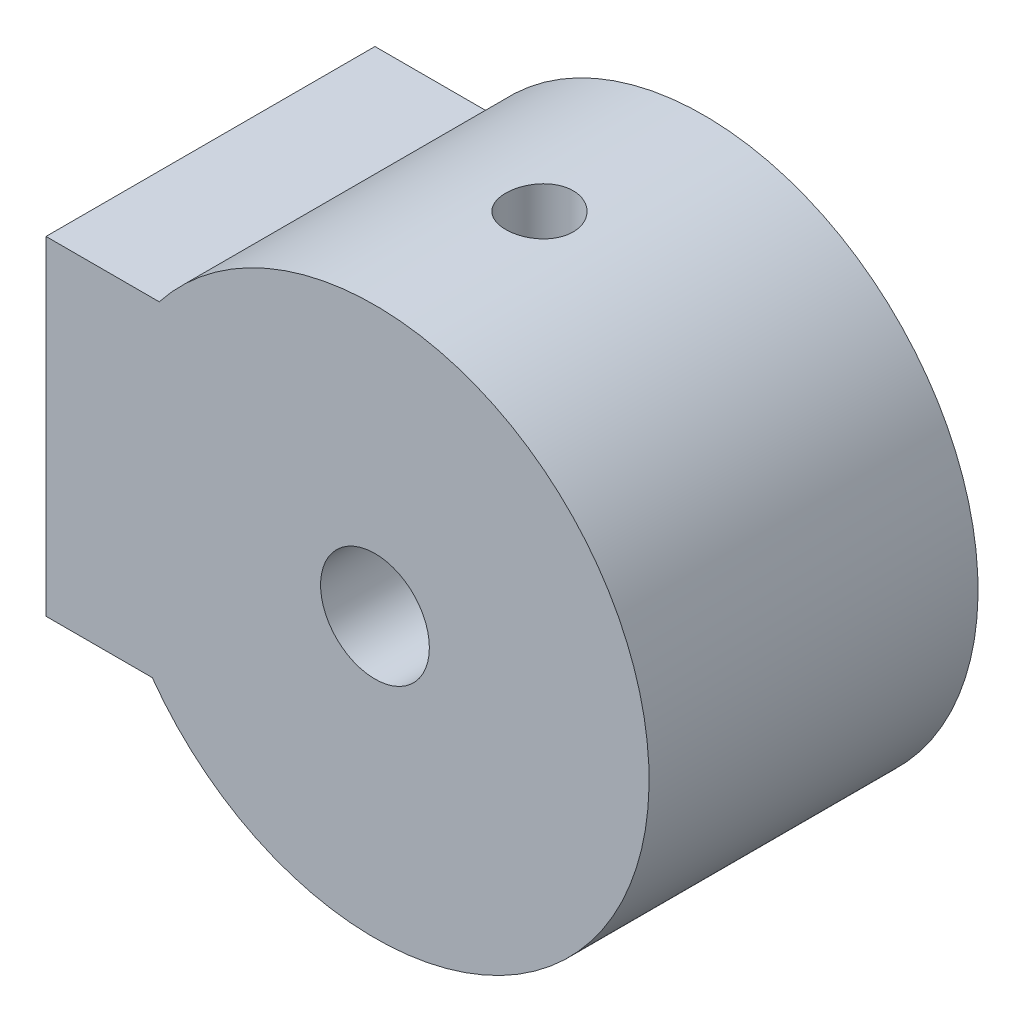
from build123d import *

# Parameters (mm, degrees)
SKETCH1_R               = 3.15
BOSS_EXTRUDE1_DEPTH     = 19.05
CUT_EXTRUDE2_REACH      = 55.695
CUT_EXTRUDE2_END_RADIUS = 3.15
CUT_EXTRUDE2_START      = 6.35
SKETCH3_R               = 1.95


with BuildPart() as part:
    # Sketch1 → Boss-Extrude1 (new body)
    with BuildSketch(Plane.XY):
        with BuildLine():
            Line((0, 19.05), (0, 0))
            Line((0, 0), (6.152664584, 0))
            ThreePointArc((6.152664584, 0), (34.921438813, 8.919808212), (6.556238945, 19.05))
            Line((6.556238945, 19.05), (0, 19.05))
        make_face()
        with Locations((19.05, 9.525)):
            Circle(SKETCH1_R, mode=Mode.SUBTRACT)
    extrude(amount=BOSS_EXTRUDE1_DEPTH)

    # Cut-Extrude2: up to this cylinder (the profile starts outside it)
    cut_extrude2_end = Plane(origin=(19.05, 9.525, 9.525), z_dir=(0, 0, -1)) * Cylinder(CUT_EXTRUDE2_END_RADIUS, 118.69, mode=Mode.PRIVATE)
    # Sketch3 → Cut-Extrude2 (cut, up to the surface)
    with BuildSketch(Plane(origin=(0, 19.05, 0), x_dir=(1, 0, 0), z_dir=(0, 1, 0)).offset(CUT_EXTRUDE2_START), mode=Mode.PRIVATE) as cut_extrude2_sk1:
        with Locations((19.05, -9.525)):
            Circle(SKETCH3_R)
    cut_extrude2_tool1 = extrude(cut_extrude2_sk1.sketch, amount=-CUT_EXTRUDE2_REACH, mode=Mode.PRIVATE) - cut_extrude2_end
    add(cut_extrude2_tool1.solids().sort_by_distance((19.05, 25.4, 9.525))[0], mode=Mode.SUBTRACT)


solid = part.part
